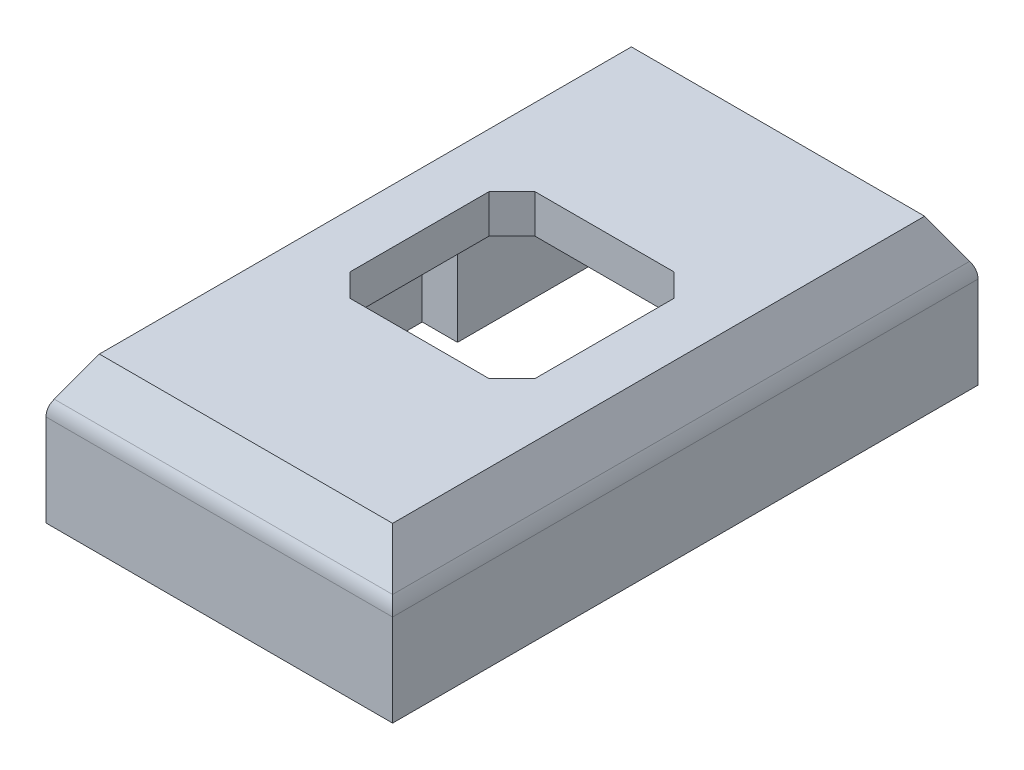
from build123d import *
from OCP.BRepFilletAPI import BRepFilletAPI_MakeChamfer

# Parameters (mm, degrees)
SKETCH1_W           = 22.5
SKETCH1_H           = 38
BOSS_EXTRUDE2_DEPTH = 7
SKETCH2_W           = 22.5
SKETCH2_H           = 38
BOSS_EXTRUDE4_DEPTH = 2.5
SKETCH3_W           = 12
SKETCH3_H           = 12
CUT_EXTRUDE1_DEPTH  = 2.5
CHAMFER1_SIZE       = 1.5
FILLET3_R           = 2
FILLET4_R           = 2
CHAMFER2_SIZE       = 3
CHAMFER2_SIZE2      = 1.732050808
FILLET5_R           = 2


with BuildPart() as part:
    # Sketch1 → Boss-Extrude2 (new body)
    with BuildSketch(Plane(origin=(0, 0, 0), x_dir=(1, 0, 0), z_dir=(0, 1, 0))):
        Rectangle(SKETCH1_W, SKETCH1_H)
        Polygon((-8.05, -15.8), (-8.05, -4.492937268), (-10.337901284, -4.492937268), (-10.337901284, 0), (-10.337901284, 4.511829369), (-8.05, 4.511829369), (-8.05, 15.8), (8.05, 15.8), (8.05, 4.494825775), (10.314669875, 4.494825775), (10.314669875, 0), (10.314669875, -4.426605317), (8.05, -4.426605317), (8.05, -15.8), align=None, mode=Mode.SUBTRACT)
    extrude(amount=BOSS_EXTRUDE2_DEPTH)

    # Sketch2 → Boss-Extrude4 (add)
    with BuildSketch(Plane(origin=(0, 7, 0), x_dir=(1, 0, 0), z_dir=(0, 1, 0))):
        Rectangle(SKETCH2_W, SKETCH2_H)
    extrude(amount=BOSS_EXTRUDE4_DEPTH)

    # Sketch3 → Cut-Extrude1 (cut)
    with BuildSketch(Plane(origin=(0, 9.5, 0), x_dir=(1, 0, 0), z_dir=(0, 1, 0))):
        Rectangle(SKETCH3_W, SKETCH3_H)
    extrude(amount=-CUT_EXTRUDE1_DEPTH, mode=Mode.SUBTRACT)

    # Chamfer1
    chamfer1_edges = [part.edges().sort_by_distance(p)[0] for p in [
        (6, 8.25, -6),
        (6, 8.25, 6),
        (-6, 8.25, 6),
        (-6, 8.25, -6),
    ]]
    chamfer(chamfer1_edges, length=CHAMFER1_SIZE)

    # Fillet3
    fillet3_edges = [part.edges().sort_by_distance(p)[0] for p in [
        (8.05, 7, 10.113302659),
        (0, 7, 15.8),
        (-8.05, 7, 10.146468634),
        (-9.193950642, 7, 4.492937268),
        (-8.05, 3.5, 15.8),
        (8.05, 3.5, 15.8),
        (-9.193950642, 7, -4.511829369),
        (-8.05, 7, -10.155914685),
        (0, 7, -15.8),
        (8.05, 7, -10.147412887),
        (9.182334937, 7, -4.494825775),
        (9.182334937, 7, 4.426605317),
    ]]
    fillet(fillet3_edges, radius=FILLET3_R)

    # Fillet4
    # the kernel refuses this fillet: 2 mm, written as the material it adds along each edge
    with BuildSketch(Plane(origin=(-6.05, 5, -13.8), x_dir=(-1, 0, 0), z_dir=(0, 0, -1))) as fillet4_piece_1_section:
        Polygon((0, 0), (FILLET4_R, 0), (FILLET4_R, FILLET4_R), (0, FILLET4_R), align=None)
    fillet4_piece_1 = extrude(amount=FILLET4_R, mode=Mode.PRIVATE)
    fillet4_piece_1 = fillet4_piece_1 - Plane(origin=(-6.05, 5, -13.8), x_dir=(0.7071067811865475, -0.7071067811865475, 0), z_dir=(0, 0, -1)) * Sphere(FILLET4_R, mode=Mode.PRIVATE)
    add(fillet4_piece_1)
    with BuildSketch(Plane(origin=(6.05, 5, -13.8), x_dir=(0, 0, -1), z_dir=(1, 0, 0))) as fillet4_piece_2_section:
        Polygon((0, 0), (FILLET4_R, 0), (FILLET4_R, FILLET4_R), (0, FILLET4_R), align=None)
    fillet4_piece_2 = extrude(amount=FILLET4_R, mode=Mode.PRIVATE)
    fillet4_piece_2 = fillet4_piece_2 - Plane(origin=(6.05, 5, -13.8), x_dir=(0, -0.7071067811865475, 0.7071067811865475), z_dir=(1, 0, 0)) * Sphere(FILLET4_R, mode=Mode.PRIVATE)
    add(fillet4_piece_2)
    with BuildSketch(Plane(origin=(8.05, 0, -15.8), x_dir=(0, 0, 1), z_dir=(0, 1, 0)), Plane(origin=(-8.05, 0, -15.8), x_dir=(1, 0, 0), z_dir=(0, 1, 0))) as fillet4_piece_3:
        with BuildLine():
            CenterArc((FILLET4_R, -FILLET4_R), FILLET4_R, 90, 90)
            Line((0, -FILLET4_R), (0, 0))
            Line((0, 0), (FILLET4_R, 0))
        make_face()
    extrude(amount=5)

    # Chamfer2: one chamfer whose edges measure the first distance from different faces: ONE call of the kernel's chamfer builder (chamfer() names one face for all edges)
    chamfer2_edges_1 = [part.edges().sort_by_distance(p)[0] for p in [
        (11.25, 9.5, 0),
    ]]
    chamfer2_side_1 = [part.faces().sort_by_distance(p)[0] for p in [
        (11.25, 4.75, 0),
    ]]
    chamfer2_edges_2 = [part.edges().sort_by_distance(p)[0] for p in [
        (0, 9.5, -19),
    ]]
    chamfer2_side_2 = [part.faces().sort_by_distance(p)[0] for p in [
        (0, 4.75, -19),
    ]]
    chamfer2_edges_3 = [part.edges().sort_by_distance(p)[0] for p in [
        (-11.25, 9.5, 0),
    ]]
    chamfer2_side_3 = [part.faces().sort_by_distance(p)[0] for p in [
        (-11.25, 4.75, 0),
    ]]
    chamfer2_edges_4 = [part.edges().sort_by_distance(p)[0] for p in [
        (0, 9.5, 19),
    ]]
    chamfer2_side_4 = [part.faces().sort_by_distance(p)[0] for p in [
        (0, 4.75, 19),
    ]]
    chamfer2 = BRepFilletAPI_MakeChamfer(part.part.solid().wrapped)
    for e in chamfer2_edges_1:
        chamfer2.Add(CHAMFER2_SIZE, CHAMFER2_SIZE2, e.wrapped, chamfer2_side_1[0].wrapped)  # the first distance lies on this face
    for e in chamfer2_edges_2:
        chamfer2.Add(CHAMFER2_SIZE, CHAMFER2_SIZE2, e.wrapped, chamfer2_side_2[0].wrapped)  # the first distance lies on this face
    for e in chamfer2_edges_3:
        chamfer2.Add(CHAMFER2_SIZE, CHAMFER2_SIZE2, e.wrapped, chamfer2_side_3[0].wrapped)  # the first distance lies on this face
    for e in chamfer2_edges_4:
        chamfer2.Add(CHAMFER2_SIZE, CHAMFER2_SIZE2, e.wrapped, chamfer2_side_4[0].wrapped)  # the first distance lies on this face
    add(Compound.cast(chamfer2.Shape()), mode=Mode.REPLACE)

    # Fillet5
    fillet5_edges = [part.edges().sort_by_distance(p)[0] for p in [
        (-11.25, 6.5, 0),
        (0, 6.5, -19),
        (11.25, 6.5, 0),
        (0, 6.5, 19),
    ]]
    fillet(fillet5_edges, radius=FILLET5_R)


solid = part.part
